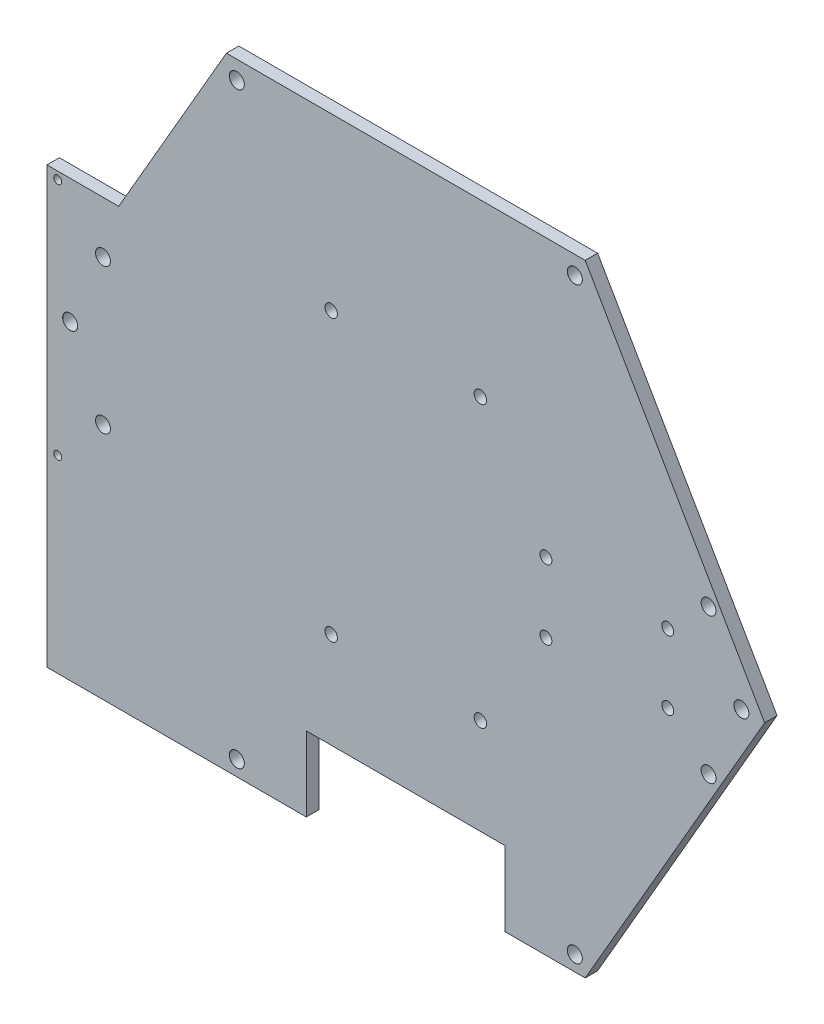
from build123d import *

# Parameters (mm, degrees)
EXTRUDE_3_DEPTH                 = 5
HOLE_WIZARD_6_0_6_1_D           = 6
HOLE_WIZARD_6_0_6_1_CSINK_D     = 6.05
HOLE_WIZARD_6_0_6_1_CSINK_ANGLE = 90
SKETCH_20_R                     = 2.4
CUT_EXTRUDE_2_DEPTH             = 192.006108105
SKETCH_33_R                     = 3
CUT_EXTRUDE_3_DEPTH             = 192.006108105
SKETCH_34_R                     = 2.5
CUT_EXTRUDE_4_DEPTH             = 192.006108105
SKETCH_35_R                     = 1.6
EXTRUDE_5_DEPTH                 = 5


with BuildPart() as part:
    # 草图8 → 凸台-拉伸3 (new body)
    with BuildSketch(Plane.XY):
        Polygon((144.337567297, 0), (72.168783649, 125), (-72.168783649, 125), (-144.337567297, 0), (-72.168783649, -125), (-40, -125), (-40, -95), (40, -95), (40, -125), (72.168783649, -125), align=None)
    extrude(amount=EXTRUDE_3_DEPTH)

    # Ø6.0 (6) 直径孔1 (through all)
    with Locations(Plane.XY.offset(5)):
        with Locations((-135.003092598, 0), (-67.980688817, -118.866778441), (-67.980688817, 117.662022204)):
            hole_wizard_6_0_6_1 = CounterSinkHole(HOLE_WIZARD_6_0_6_1_D / 2, HOLE_WIZARD_6_0_6_1_CSINK_D / 2, counter_sink_angle=HOLE_WIZARD_6_0_6_1_CSINK_ANGLE)

    # 镜向2: Ø6.0 (6) 直径孔1 across plane
    add(hole_wizard_6_0_6_1.mirror(Plane(origin=(0, 0, 0), x_dir=(0, 0, 1), z_dir=(1, 0, 0))), mode=Mode.SUBTRACT)

    # 草图20 → 切除-拉伸2 (cut, through all)
    with BuildSketch(Plane.XY.offset(5)):
        with Locations((56.370867728, 13.653021969)):
            Circle(SKETCH_20_R)
        with Locations((105.370867728, 13.324633606)):
            Circle(SKETCH_20_R)
        with Locations((56.370867728, -14.346978031)):
            Circle(SKETCH_20_R)
        with Locations((105.370867728, -14.346978031)):
            Circle(SKETCH_20_R)
    extrude(amount=-CUT_EXTRUDE_2_DEPTH, mode=Mode.SUBTRACT)

    # 草图33 → 切除-拉伸3 (cut, through all)
    with BuildSketch(Plane.XY.offset(5)):
        with Locations((-121.797773, -29.181235)):
            Circle(SKETCH_33_R)
        with Locations((121.797773, -29.181235)):
            Circle(SKETCH_33_R)
        with Locations((121.797773, 29.181235)):
            Circle(SKETCH_33_R)
        with Locations((-121.797773, 29.181235)):
            Circle(SKETCH_33_R)
    extrude(amount=-CUT_EXTRUDE_3_DEPTH, mode=Mode.SUBTRACT)

    # 草图34 → 切除-拉伸4 (cut, through all)
    with BuildSketch(Plane.XY.offset(5)):
        with Locations((-30, -56.392396)):
            Circle(SKETCH_34_R)
        with Locations((30, -56.392396)):
            Circle(SKETCH_34_R)
        with Locations((30, 56.392396)):
            Circle(SKETCH_34_R)
        with Locations((-30, 56.392396)):
            Circle(SKETCH_34_R)
    extrude(amount=-CUT_EXTRUDE_4_DEPTH, mode=Mode.SUBTRACT)

    # 草图35 → 凸台-拉伸5 (add)
    # profile 1 of 2: a face of its own
    with BuildSketch(Plane.XY):
        Polygon((-144.337567297, 0), (-115.470053838, 50), (-144.337567297, 50), align=None)
        with Locations((-140, 47)):
            Circle(SKETCH_35_R, mode=Mode.SUBTRACT)
    # profile 2 of 2: a face of its own
    with BuildSketch(Plane.XY):
        Polygon((-72.168783649, -125), (-144.337567297, 0), (-144.337567297, -125), align=None)
        with Locations((-140, -49)):
            Circle(SKETCH_35_R, mode=Mode.SUBTRACT)
    extrude(amount=EXTRUDE_5_DEPTH)


solid = part.part
